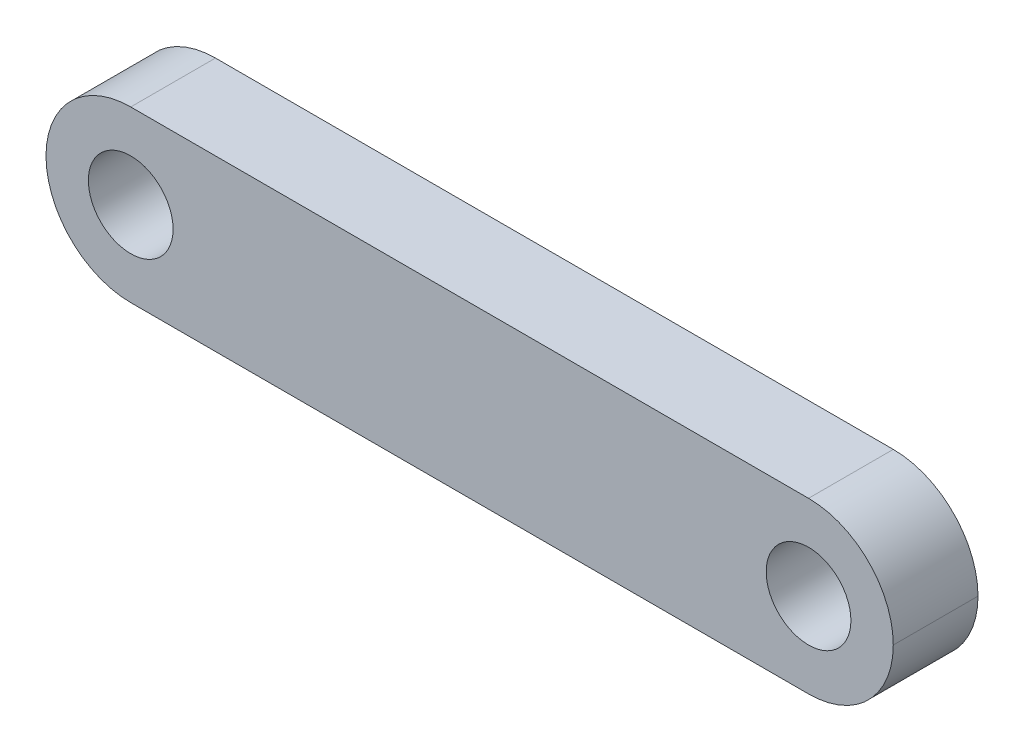
from build123d import *

# Parameters (mm, degrees)
SKETCH1_W           = 100
SKETCH1_H           = 20
BOSS_EXTRUDE1_DEPTH = 10
FILLET1_R           = 10
SKETCH5_R           = 5
CUT_EXTRUDE1_DEPTH  = 103.46950766


with BuildPart() as part:
    # Sketch1 → Boss-Extrude1 (new body)
    with BuildSketch(Plane.XY):
        with Locations((50, 10)):
            Rectangle(SKETCH1_W, SKETCH1_H)
    extrude(amount=BOSS_EXTRUDE1_DEPTH)

    # Fillet1
    fillet1_edges = [part.edges().sort_by_distance(p)[0] for p in [
        (100, 20, 5),
        (100, 0, 5),
        (0, 0, 5),
        (0, 20, 5),
    ]]
    fillet(fillet1_edges, radius=FILLET1_R - 0.0001)  # a hair under: the kernel refuses the full size

    # Sketch5 → Cut-Extrude1 (cut, through all)
    with BuildSketch(Plane.XY.offset(10)):
        with Locations((10, 10)):
            Circle(SKETCH5_R)
        with Locations((90, 10)):
            Circle(SKETCH5_R)
    extrude(amount=-CUT_EXTRUDE1_DEPTH, mode=Mode.SUBTRACT)


solid = part.part
